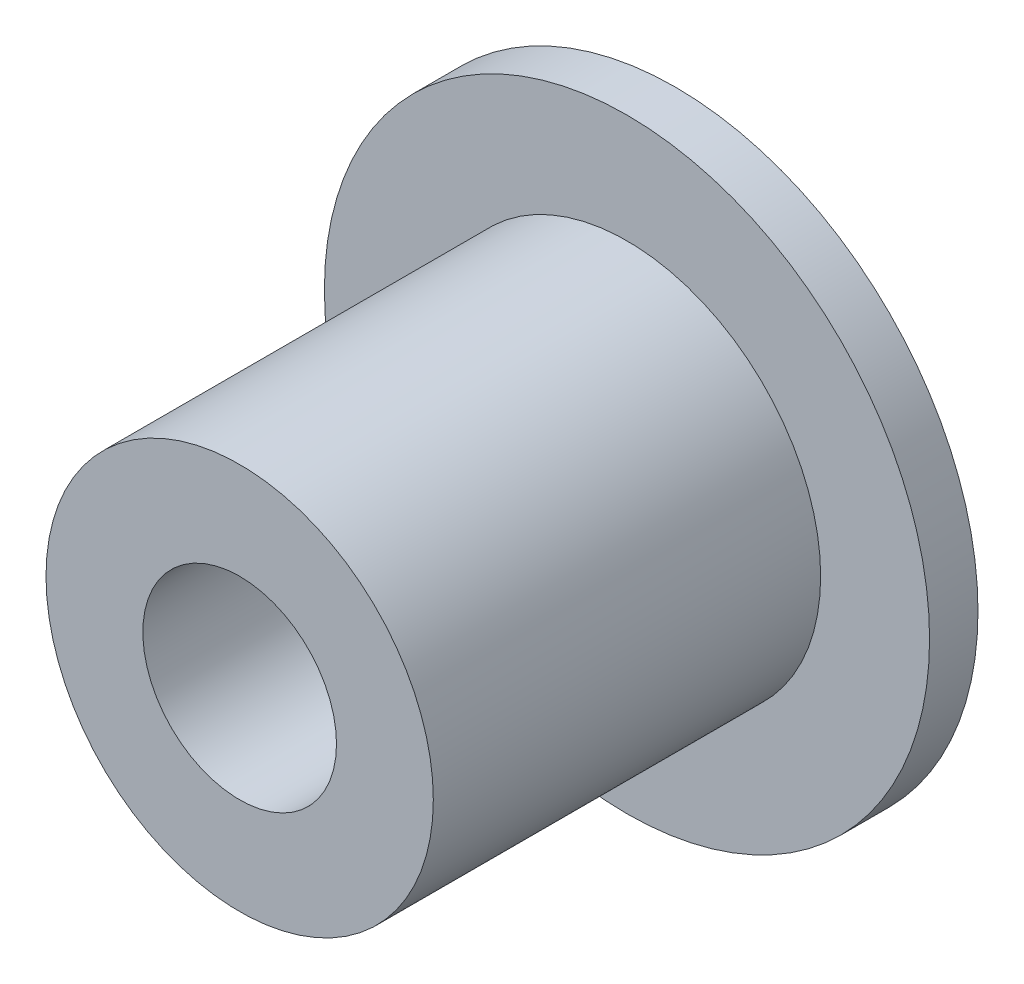
from build123d import *

# Parameters (mm, degrees)
SKETCH1_R           = 12.7
SKETCH1_R_2         = 6.35
BOSS_EXTRUDE1_DEPTH = 3.175
SKETCH2_R           = 19.84375
SKETCH2_R_2         = 6.35
BOSS_EXTRUDE2_DEPTH = 3.175
SKETCH3_R           = 12.7
SKETCH3_R_2         = 6.35
BOSS_EXTRUDE3_DEPTH = 25.4
SKETCH4_W           = 3.175
SKETCH4_H           = 9.525
CUT_EXTRUDE1_DEPTH  = 22.225


with BuildPart() as part:
    # Sketch1 → Boss-Extrude1 (new body)
    with BuildSketch(Plane.XY):
        Circle(SKETCH1_R)
        Circle(SKETCH1_R_2, mode=Mode.SUBTRACT)
    extrude(amount=BOSS_EXTRUDE1_DEPTH)

    # Sketch2 → Boss-Extrude2 (add)
    with BuildSketch(Plane.XY.offset(3.175)):
        Circle(SKETCH2_R)
        Circle(SKETCH2_R_2, mode=Mode.SUBTRACT)
    extrude(amount=BOSS_EXTRUDE2_DEPTH)

    # Sketch3 → Boss-Extrude3 (add)
    with BuildSketch(Plane.XY.offset(6.35)):
        Circle(SKETCH3_R)
        Circle(SKETCH3_R_2, mode=Mode.SUBTRACT)
    extrude(amount=BOSS_EXTRUDE3_DEPTH)

    # Sketch4 → Cut-Extrude1 (cut)
    with BuildSketch(Plane(origin=(0, 0, 0), x_dir=(-1, 0, 0), z_dir=(0, 0, -1))):
        with Locations((0, 4.7625)):
            Rectangle(SKETCH4_W, SKETCH4_H)
    extrude(amount=-CUT_EXTRUDE1_DEPTH, mode=Mode.SUBTRACT)


solid = part.part
